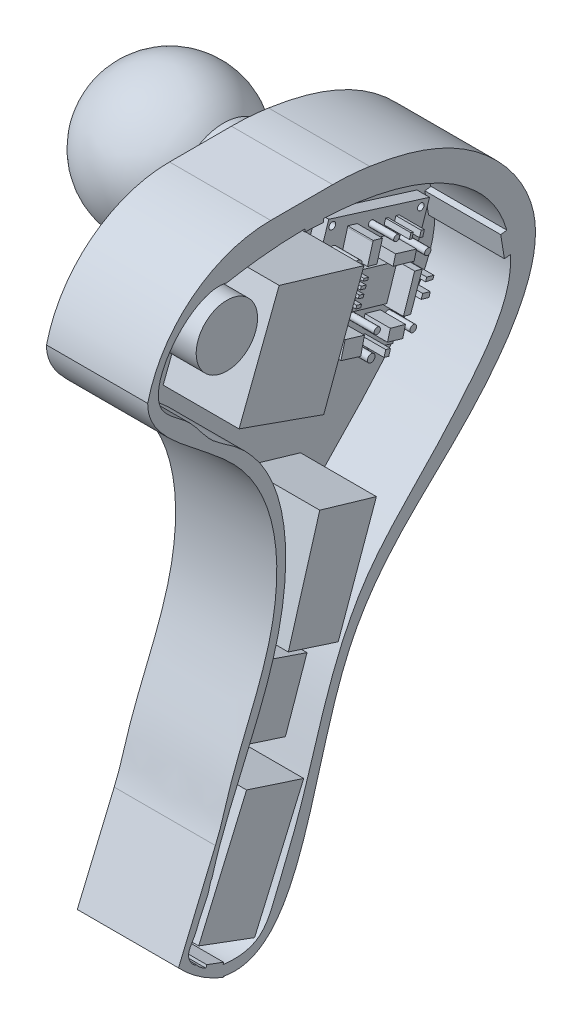
from build123d import *

# Parameters (mm, degrees)
BOSS_EXTRUDE1_DEPTH  = 4
CUT_EXTRUDE3_START   = -10
CUT_EXTRUDE3_DEPTH   = 10
CUT_EXTRUDE4_DEPTH   = 10
FILLET4_START        = -1
FILLET4_DEPTH        = 6
SKETCH7_RX           = 1.83432271
SKETCH7_RY           = 1.648181576
BOSS_EXTRUDE2_DEPTH  = 3
SKETCH8_R            = 1.941403724
BOSS_EXTRUDE3_DEPTH  = 0.5
CUT_EXTRUDE5_DEPTH   = 5
CUT_EXTRUDE6_DEPTH   = 3
CUT_EXTRUDE7_DEPTH   = 3
BOSS_EXTRUDE4_DEPTH  = 3
SKETCH14_R           = 1.213241118
BOSS_EXTRUDE5_DEPTH  = 3
BOSS_EXTRUDE6_DEPTH  = 2
BOSS_EXTRUDE7_DEPTH  = 3
BOSS_EXTRUDE8_DEPTH  = 3
BOSS_EXTRUDE9_DEPTH  = 3
BOSS_EXTRUDE10_DEPTH = 3
BOSS_EXTRUDE11_DEPTH = 0.5
BOSS_EXTRUDE12_DEPTH = 0.5
SKETCH22_R           = 0.134981106
SKETCH22_R_2         = 0.131188797
SKETCH22_R_3         = 0.166295784
SKETCH22_R_4         = 0.158734838
CUT_EXTRUDE8_DEPTH   = 1
SKETCH23_R           = 0.182055945
SKETCH23_R_2         = 0.183819515
SKETCH23_R_3         = 0.185330788
SKETCH23_R_4         = 0.192848015
SKETCH23_R_5         = 0.056655837
SKETCH23_R_6         = 0.125233107
SKETCH23_R_7         = 0.115842199
SKETCH23_R_8         = 0.125116526
SKETCH23_R_9         = 0.133280712
SKETCH23_R_10        = 0.152580639
BOSS_EXTRUDE13_DEPTH = 1
BOSS_EXTRUDE14_DEPTH = 1
BOSS_EXTRUDE15_DEPTH = 1
BOSS_EXTRUDE16_DEPTH = 3


with BuildPart() as part:
    # Sketch1 → Boss-Extrude1 (new body)
    with BuildSketch(Plane(origin=(0, 0, 0), x_dir=(0, 0, -1), z_dir=(1, 0, 0))):
        with BuildLine():
            Line((6.442518848, 0), (13.409619329, 0))
            ThreePointArc((13.409619329, 0), (16.945153235, -1.464466094), (18.409619329, -5))
            Line((18.409619329, -5), (18.409619329, -20.34540211))
            ThreePointArc((18.409619329, -20.34540211), (16.945153235, -23.880936016), (13.409619329, -25.34540211))
            Line((13.409619329, -25.34540211), (6.442518848, -25.34540211))
            ThreePointArc((6.442518848, -25.34540211), (2.906984942, -23.880936016), (1.442518848, -20.34540211))
            Line((1.442518848, -20.34540211), (1.442518848, -5))
            ThreePointArc((1.442518848, -5), (2.906984942, -1.464466094), (6.442518848, 0))
        make_face()
    extrude(amount=BOSS_EXTRUDE1_DEPTH)

    # Sketch2 → Cut-Extrude3 (cut)
    with BuildSketch(Plane(origin=(4, 0, 0), x_dir=(0, 0, -1), z_dir=(1, 0, 0)).offset(CUT_EXTRUDE3_START)):
        with BuildLine():
            add(Edge.make_bspline(
                [(2.42884403, -23.286077848), (2.370716158, -22.573896831), (4.185530255, -21.12926271), (4.874517164, -17.962112227), (7.118988975, -13.802662727), (6.544049448, -7.530329658), (1.569055746, -5.349803368), (1.58046752, -3.833613753)],
                knots=[0.531334438, 0.531334438, 0.531334438, 0.531334438, 0.570400737, 0.608236932, 0.680812242, 0.778589658, 0.857107486, 0.857107486, 0.857107486, 0.857107486], degree=3))
            ThreePointArc((1.58046752, -3.833613753), (1.47712578, -4.412742239), (1.442518848, -5))
            Line((1.442518848, -5), (1.442518848, -20.34540211))
            ThreePointArc((1.442518848, -20.34540211), (1.683757797, -21.87974016), (2.384196149, -23.266021372))
            add(Edge.make_bspline(
                [(2.384196149, -23.266021372), (2.399070873, -23.272759012), (2.413953527, -23.279444568), (2.428844038, -23.286077844)],
                knots=[0.998981394, 0.998981394, 0.998981394, 0.998981394, 0.999513034, 0.999513034, 0.999513034, 0.999513034], degree=3))
        make_face()
        with BuildLine():
            Line((13.409619329, 0), (9.46398266, 0))
            add(Edge.make_bspline(
                [(9.46398266, 0), (11.207503001, -0.168664697), (14.40943711, -0.885845558), (18.093070912, -5.600973008), (14.034927819, -11.50687924), (8.23474836, -15.211494887), (7.662204752, -25.591568315), (4.542739971, -24.937885151)],
                knots=[0, 0, 0, 0, 0.077946221, 0.143334379, 0.228662798, 0.345497184, 0.490655992, 0.490655992, 0.490655992, 0.490655992], degree=3))
            add(Edge.make_bspline(
                [(4.54273997, -24.937885153), (5.749127141, -25.532851997), (7.208451258, -25.09277451), (8.521498661, -25.334156754), (8.57622256, -25.34540211)],
                knots=[0.001400322, 0.001400322, 0.001400322, 0.001400322, 0.038459748, 0.040079073, 0.040079073, 0.040079073, 0.040079073], degree=3))
            Line((8.57622256, -25.34540211), (13.409619329, -25.34540211))
            ThreePointArc((13.409619329, -25.34540211), (16.945153235, -23.880936016), (18.409619329, -20.34540211))
            Line((18.409619329, -20.34540211), (18.409619329, -5))
            ThreePointArc((18.409619329, -5), (16.945153235, -1.464466094), (13.409619329, 0))
        make_face()
        with BuildLine():
            ThreePointArc((2.906984942, -1.464466094), (4.529101686, -0.380602337), (6.442518848, 0))
            add(Edge.make_bspline(
                [(6.442518848, 0), (7.443592251, 0.121124965), (8.454170968, 0.097687179), (9.46398266, 0)],
                knots=[0.954855127, 0.954855127, 0.954855127, 0.954855127, 1, 1, 1, 1], degree=3))
            Line((9.46398266, 0), (13.409619329, 0))
            ThreePointArc((13.409619329, 0), (16.945153235, -1.464466094), (18.409619329, -5))
            Line((18.409619329, -5), (18.409619329, -20.34540211))
            ThreePointArc((18.409619329, -20.34540211), (16.945153235, -23.880936016), (13.409619329, -25.34540211))
            Line((13.409619329, -25.34540211), (8.57622256, -25.34540211))
            add(Edge.make_bspline(
                [(8.57622256, -25.34540211), (10.509849295, -25.742748085), (21.004932545, -37.507061135), (40.108036136, 7.046689321), (11.067178354, 5.045725954), (-13.182357735, 4.105959789), (-4.736766595, -20.04051671), (2.384196149, -23.266021372)],
                knots=[0.040079073, 0.040079073, 0.040079073, 0.040079073, 0.09729665, 0.409886449, 0.593670055, 0.744469586, 0.998981394, 0.998981394, 0.998981394, 0.998981394], degree=3))
            ThreePointArc((2.384196149, -23.266021372), (1.683757797, -21.87974016), (1.442518848, -20.34540211))
            Line((1.442518848, -20.34540211), (1.442518848, -5))
            ThreePointArc((1.442518848, -5), (1.47712578, -4.412742239), (1.58046752, -3.833613753))
            add(Edge.make_bspline(
                [(1.58046752, -3.833613753), (1.586363874, -3.050213083), (2.186842654, -2.121305338), (2.906984942, -1.464466094)],
                knots=[0.857107486, 0.857107486, 0.857107486, 0.857107486, 0.897676897, 0.897676897, 0.897676897, 0.897676897], degree=3))
        make_face()
    extrude(amount=CUT_EXTRUDE3_DEPTH, mode=Mode.SUBTRACT)

    # Sketch6 → Cut-Extrude4 (cut)
    with BuildSketch(Plane(origin=(4, 0, 0), x_dir=(0, 0, -1), z_dir=(1, 0, 0))):
        with BuildLine():
            add(Edge.make_bspline(
                [(6.876629539, -24.646378986), (6.348652857, -24.697603605), (5.705170416, -25.181041107), (2.967179599, -24.643973727), (6.798679283, -26.524715176), (10.198220508, -25.437781208), (7.742791771, -24.562343399), (6.876629539, -24.646378986)],
                knots=[0, 0, 0, 0, 0.142115473, 0.262842986, 0.576183637, 0.76685513, 1, 1, 1, 1], degree=3))
        make_face()
    extrude(amount=-CUT_EXTRUDE4_DEPTH, mode=Mode.SUBTRACT)

    # Fillet4: read off the stored shape, not the designer's step
    # Fillet4 outline → Fillet4 (cut)
    with BuildSketch(Plane.YZ.offset(FILLET4_START)):
        with BuildLine():
            ThreePointArc((0, -8.890200058), (-0.027061887, -9.625390775), (-0.108101078, -10.356602363))
            add(Edge.make_bspline(
                [(0, -9.46398266), (-0.028832047, -9.762025236), (-0.064132076, -10.060000995), (-0.108101078, -10.356602363)],
                knots=[0, 0, 0, 0, 0.01332436, 0.01332436, 0.01332436, 0.01332436], degree=3))
            Line((0, -9.46398266), (0, -8.890200058))
        make_face()
    extrude(amount=FILLET4_DEPTH, mode=Mode.SUBTRACT)

    # Sketch7 → Boss-Extrude2 (add)
    with BuildSketch(Plane.ZY):
        with Locations(Location((-12.079238976, -5.176946967), (0, 0, 66.52385958))):
            Ellipse(SKETCH7_RX, SKETCH7_RY)
    extrude(amount=BOSS_EXTRUDE2_DEPTH)

    # Sketch8 → Boss-Extrude3 (add)
    with BuildSketch(Plane.ZY.offset(3)):
        with Locations((-12.079238976, -5.176946967)):
            Circle(SKETCH8_R)
    extrude(amount=BOSS_EXTRUDE3_DEPTH)

    # Dome1: read off the stored shape, not the designer's step
    # Dome1 outline → Dome1 (revolve)
    with BuildSketch(Plane(origin=(0, -5.176946967, -12.079238976), x_dir=(0, 1, 0), z_dir=(0, 0, -1))):
        with BuildLine():
            Line((0, -3.499999998), (0, -8.5))
            ThreePointArc((0, -8.5), (2.681839314, -6.664401723), (1.941403723, -3.499999999))
            Line((1.941403723, -3.499999999), (0, -3.499999998))
        make_face()
    revolve(axis=Axis((0, -5.176946967, -12.079238976), (1, 0, 0)))

    # Sketch9 → Cut-Extrude5 (cut)
    with BuildSketch(Plane.ZY):
        with BuildLine():
            Line((-4.325838527, -20.140987675), (-2.486204677, -24.505449301))
            add(Edge.make_bspline(
                [(-2.486204677, -24.505449301), (3.73593799, -24.171685926), (-2.121854058, -16.126748366), (-4.325838527, -20.140987675)],
                knots=[0, 0, 0, 0, 1, 1, 1, 1], degree=3))
        make_face()
    extrude(amount=-CUT_EXTRUDE5_DEPTH, mode=Mode.SUBTRACT)

    # Sketch10 → Cut-Extrude6 (cut)
    with BuildSketch(Plane(origin=(4, 0, 0), x_dir=(0, 0, -1), z_dir=(1, 0, 0))):
        with BuildLine():
            add(Edge.make_bspline(
                [(4.704847773, -1.268793553), (6.796173346, -0.886684544), (9.975620403, -0.797866858), (13.742626206, -2.189700587), (15.694389366, -4.082173188), (16.199843728, -6.920337819), (14.546843178, -9.297077142), (12.48922231, -11.601526403), (9.936920238, -14.067437575), (8.543487711, -17.51903509), (7.675719492, -20.718590709), (6.758806818, -22.875132772), (5.909206583, -24.991760276), (1.899557113, -24.102423599), (4.829064309, -22.043795228), (4.113756429, -21.383552535)],
                knots=[0, 0, 0, 0, 0.160846626, 0.232246385, 0.2976696, 0.356292938, 0.432133463, 0.502823461, 0.59256237, 0.694749231, 0.778078313, 0.840616953, 0.875649141, 0.937594134, 1, 1, 1, 1], degree=3))
            add(Edge.make_bspline(
                [(4.704847773, -1.268793553), (3.34923582, -0.909927828), (0.866720981, -3.918827436), (3.314528053, -5.198627762), (3.942667118, -6.340722465), (5.121287909, -7.029711872), (7.134077591, -9.164336983), (7.311703654, -15.042228183), (4.834518066, -18.816674345), (4.113756429, -21.383552535)],
                knots=[0, 0, 0, 0, 0.184306328, 0.246620763, 0.305445453, 0.347313442, 0.416681225, 0.670628587, 1, 1, 1, 1], degree=3))
        make_face()
    extrude(amount=-CUT_EXTRUDE6_DEPTH, mode=Mode.SUBTRACT)

    # Sketch11 → Cut-Extrude7 (cut)
    with BuildSketch(Plane(origin=(4, 0, 0), x_dir=(0, 0, -1), z_dir=(1, 0, 0))):
        with BuildLine():
            add(Edge.make_bspline(
                [(4.440829884, -21.343744857), (4.319663309, -21.311159839), (4.085041975, -21.312722466), (4.024558064, -21.653857711), (3.894348686, -22.020150397), (3.630726679, -22.457781913), (3.465727617, -23.033135084), (3.027801726, -23.520866952), (3.62788055, -24.313325566), (4.070211229, -22.856043168), (5.396750758, -22.305995381), (4.732479716, -21.422177502), (4.440829884, -21.343744857)],
                knots=[0, 0, 0, 0, 0.049789649, 0.085794926, 0.138624904, 0.232488547, 0.311313264, 0.41356729, 0.492510509, 0.611264962, 0.880155541, 1, 1, 1, 1], degree=3))
        make_face()
    extrude(amount=-CUT_EXTRUDE7_DEPTH, mode=Mode.SUBTRACT)

    # Sketch12 → Boss-Extrude4 (add)
    with BuildSketch(Plane(origin=(1, 0, 0), x_dir=(0, 0, -1), z_dir=(1, 0, 0))):
        Polygon((5.488474661, -19.021525994), (7.746674891, -19.755105386), (5.806033984, -24.23583982), (3.595975266, -23.413861276), align=None)
    extrude(amount=BOSS_EXTRUDE4_DEPTH)

    # Sketch14 → Boss-Extrude5 (add)
    with BuildSketch(Plane(origin=(1, 0, 0), x_dir=(0, 0, -1), z_dir=(1, 0, 0))):
        with Locations(Location((4.709040057, -3.079088864, 0), (0, 0, 180))):
            Circle(SKETCH14_R)
    extrude(amount=BOSS_EXTRUDE5_DEPTH)

    # Sketch15 → Boss-Extrude6 (add)
    with BuildSketch(Plane(origin=(1, 0, 0), x_dir=(0, 0, -1), z_dir=(1, 0, 0))):
        Polygon((6.698889603, -15.771150379), (8.878492778, -16.514705041), (8.022592202, -18.963252771), (5.676430764, -18.205922513), align=None)
    extrude(amount=BOSS_EXTRUDE6_DEPTH)

    # Sketch16 → Boss-Extrude7 (add)
    with BuildSketch(Plane(origin=(1, 0, 0), x_dir=(0, 0, -1), z_dir=(1, 0, 0))):
        Polygon((6.776319444, -2.391988621), (10.127021568, -3.390915952), (8.5385992, -7.696090748), (5.190830748, -6.511811016), align=None)
    extrude(amount=BOSS_EXTRUDE7_DEPTH)

    # Sketch17 → Boss-Extrude8 (add)
    with BuildSketch(Plane(origin=(1, 0, 0), x_dir=(0, 0, -1), z_dir=(1, 0, 0))):
        Polygon((15.815921532, -4.995802221), (15.534632749, -5.032835606), (15.680242906, -5.932205267), (15.955390033, -5.903687127), align=None)
    extrude(amount=BOSS_EXTRUDE8_DEPTH)

    # Sketch18 → Boss-Extrude9 (add)
    with BuildSketch(Plane(origin=(1, 0, 0), x_dir=(0, 0, -1), z_dir=(1, 0, 0))):
        Polygon((7.794317835, -0.90681317), (8.528408199, -0.95490082), (8.528408199, -1.118884883), (7.794317835, -1.070797232), align=None)
    extrude(amount=BOSS_EXTRUDE9_DEPTH)

    # Sketch19 → Boss-Extrude10 (add)
    with BuildSketch(Plane(origin=(1, 0, 0), x_dir=(0, 0, -1), z_dir=(1, 0, 0))):
        Polygon((3.916076149, -24.216309846), (4.576914487, -24.460903955), (4.546712481, -24.627295983), (3.860898053, -24.40411005), align=None)
    extrude(amount=BOSS_EXTRUDE10_DEPTH)

    # Sketch20 → Boss-Extrude11 (add)
    with BuildSketch(Plane(origin=(1, 0, 0), x_dir=(0, 0, -1), z_dir=(1, 0, 0))):
        Polygon((11.239919087, -3.610127439), (15.22110765, -4.847486551), (13.767873958, -9.127538051), (9.815958954, -7.905272882), align=None)
    extrude(amount=BOSS_EXTRUDE11_DEPTH)

    # Sketch21 → Boss-Extrude12 (add)
    with BuildSketch(Plane(origin=(1.5, 0, 0), x_dir=(0, 0, -1), z_dir=(1, 0, 0))):
        Polygon((12.070185666, -5.498922698), (13.442349007, -5.900491081), (13.02751515, -7.140139514), (11.647813017, -6.739986932), align=None)
    extrude(amount=BOSS_EXTRUDE12_DEPTH)

    # Sketch22 → Cut-Extrude8 (cut)
    with BuildSketch(Plane(origin=(1.5, 0, 0), x_dir=(0, 0, -1), z_dir=(1, 0, 0))):
        with Locations((11.377600633, -3.900903252)):
            Circle(SKETCH22_R)
        with Locations((14.874957492, -5.000480054)):
            Circle(SKETCH22_R_2)
        with Locations((10.219202662, -7.688462314)):
            Circle(SKETCH22_R_3)
        with Locations((13.534604417, -8.740649676)):
            Circle(SKETCH22_R_4)
    extrude(amount=-CUT_EXTRUDE8_DEPTH, mode=Mode.SUBTRACT)

    # Sketch23 → Boss-Extrude13 (add)
    with BuildSketch(Plane(origin=(1.5, 0, 0), x_dir=(0, 0, -1), z_dir=(1, 0, 0))):
        with Locations((11.376175391, -4.772723364)):
            Circle(SKETCH23_R)
        with Locations((11.194119446, -5.327878666)):
            Circle(SKETCH23_R_2)
        with Locations((11.052338778, -5.859675236)):
            Circle(SKETCH23_R_3)
        with Locations((10.86700799, -6.390664757)):
            Circle(SKETCH23_R_4)
        with Locations((10.674159975, -6.930935007)):
            Circle(SKETCH23_R_5)
        with Locations((14.150337219, -5.674344448)):
            Circle(SKETCH23_R_6)
        with Locations((12.920106259, -4.590667419)):
            Circle(SKETCH23_R_7)
        with Locations((12.155202467, -7.385034433)):
            Circle(SKETCH23_R_8)
        with Locations((13.57791078, -8.018531503)):
            Circle(SKETCH23_R_9)
        with Locations((11.915296787, -8.204249815)):
            Circle(SKETCH23_R_10)
    extrude(amount=BOSS_EXTRUDE13_DEPTH)

    # Sketch24 → Boss-Extrude14 (add)
    with BuildSketch(Plane(origin=(1.5, 0, 0), x_dir=(0, 0, -1), z_dir=(1, 0, 0))):
        Polygon((11.978440435, -4.256898406), (11.770709936, -4.9944235), (12.139607678, -5.098326827), (12.359861298, -4.316339717), (11.990826211, -4.21076561), align=None)
        Polygon((12.87873926, -5.113572924), (13.705625633, -5.360814626), (13.611200907, -5.730470559), (12.778244514, -5.490083149), align=None)
        Polygon((13.632093873, -6.079211775), (13.932811537, -6.159082101), (13.474226976, -7.487275958), (13.188991095, -7.409902493), align=None)
        Polygon((12.671738205, -7.558338606), (13.269699328, -7.722891341), (13.161835896, -8.15478921), (12.557916655, -7.97805014), align=None)
        Polygon((10.883971601, -7.053638433), (11.647968886, -7.282048004), (11.499668654, -7.933174378), (10.718407651, -7.690066312), align=None)
    extrude(amount=BOSS_EXTRUDE14_DEPTH)

    # Sketch25 → Boss-Extrude15 (add)
    with BuildSketch(Plane(origin=(1.5, 0, 0), x_dir=(0, 0, -1), z_dir=(1, 0, 0))):
        Polygon((11.62768136, -5.327272966), (11.805790351, -5.377197999), (11.781303854, -5.46455428), (11.603507213, -5.415028346), align=None)
        Polygon((11.523875481, -5.543202327), (11.716735855, -5.597262263), (11.68541833, -5.708988432), (11.486125171, -5.653125348), align=None)
        Polygon((11.443381237, -5.805615558), (11.62768136, -5.868908822), (11.590872615, -5.976090152), (11.406572492, -5.912796888), align=None)
        Polygon((11.340377207, -6.105547246), (11.535531299, -6.160250125), (11.505000326, -6.269170246), (11.311422771, -6.21988089), align=None)
        Polygon((13.484502011, -4.694666253), (13.42729782, -4.895845789), (13.524290495, -4.923425072), (13.581494686, -4.722245537), align=None)
        Polygon((13.888961701, -4.809671934), (14.01623834, -4.84586228), (13.95260002, -5.069669788), (13.825323382, -5.033479441), align=None)
        Polygon((14.107329746, -6.522462838), (14.392535534, -6.603559389), (14.356699024, -6.72959163), (14.066352175, -6.666575509), align=None)
        Polygon((13.95260002, -7.006736057), (14.24993264, -7.0912808), (14.199605398, -7.268275019), (13.888961701, -7.179945352), align=None)
        Polygon((12.488824959, -8.196330074), (12.67690538, -8.249809611), (12.610085546, -8.484806087), (12.422005124, -8.43132655), align=None)
    extrude(amount=BOSS_EXTRUDE15_DEPTH)

    # Sketch26 → Boss-Extrude16 (add)
    with BuildSketch(Plane(origin=(1, 0, 0), x_dir=(0, 0, -1), z_dir=(1, 0, 0))):
        Polygon((8.381298535, -10.889369981), (10.620044662, -11.544546835), (9.109735693, -15.760441133), (7.138666394, -15.124238796), align=None)
    extrude(amount=BOSS_EXTRUDE16_DEPTH)


solid = part.part
